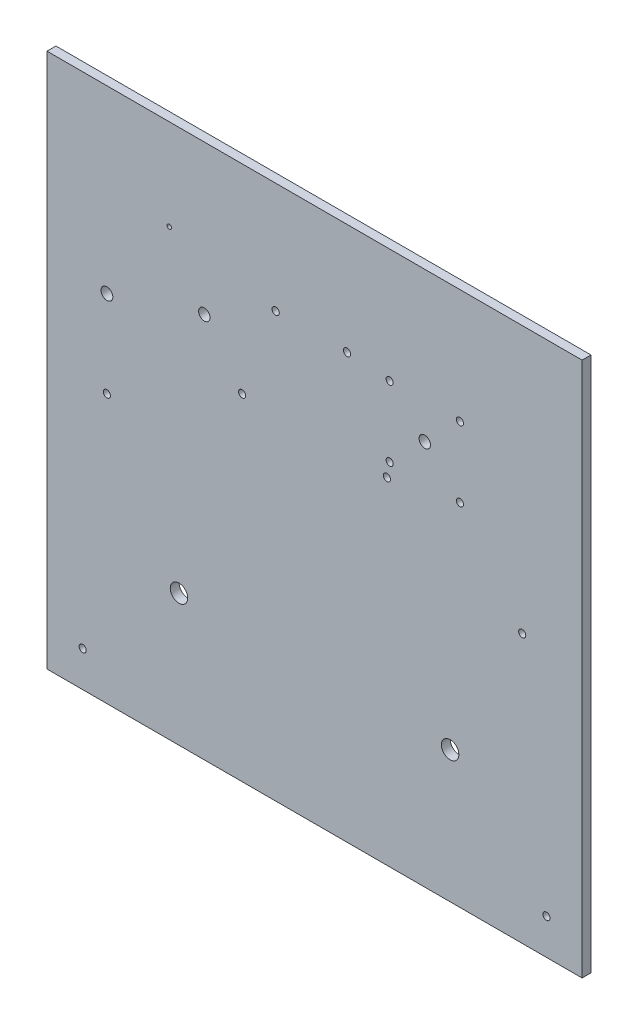
from build123d import *

# Parameters (mm, degrees)
SKETCH1_W               = 381
SKETCH1_H               = 381
SKETCH1_R               = 4.064
SKETCH1_R_2             = 2.54
SKETCH1_R_3             = 6.223
SKETCH1_R_4             = 2.5796875
SKETCH1_R_5             = 1.5875
BOSS_EXTRUDE1_DEPTH     = 6.35
F_3_8_24_TAPPED_HOLE2_D = 8.4328


with BuildPart() as part:
    # Sketch1 → Boss-Extrude1 (new body)
    with BuildSketch(Plane.XY):
        with Locations((27.686, -103.707177239)):
            Rectangle(SKETCH1_W, SKETCH1_H)
        with Locations((106.172, -19.5453)):
            Circle(SKETCH1_R, mode=Mode.SUBTRACT)
        with Locations((79.231231637, -55.022746953)):
            Circle(SKETCH1_R_2, mode=Mode.SUBTRACT)
        with Locations((192.786, -268.807177239)):
            Circle(SKETCH1_R_2, mode=Mode.SUBTRACT)
        with Locations((-137.414, -268.807177239)):
            Circle(SKETCH1_R_2, mode=Mode.SUBTRACT)
        with Locations((131.172, 5.4547)):
            Circle(SKETCH1_R_2, mode=Mode.SUBTRACT)
        with Locations((175.53653879, -103.112365579)):
            Circle(SKETCH1_R_2, mode=Mode.SUBTRACT)
        with Locations((131.172, -44.5453)):
            Circle(SKETCH1_R_2, mode=Mode.SUBTRACT)
        with Locations((124.206, -200.410050779)):
            Circle(SKETCH1_R_3, mode=Mode.SUBTRACT)
        with Locations((-68.834, -200.410050779)):
            Circle(SKETCH1_R_3, mode=Mode.SUBTRACT)
        with Locations((81.172, -44.5453)):
            Circle(SKETCH1_R_2, mode=Mode.SUBTRACT)
        with Locations((-120.16453879, -103.112365579)):
            Circle(SKETCH1_R_2, mode=Mode.SUBTRACT)
        with Locations((81.172, 5.4547)):
            Circle(SKETCH1_R_2, mode=Mode.SUBTRACT)
        with Locations((0, 7.933100659)):
            Circle(SKETCH1_R_4, mode=Mode.SUBTRACT)
        with Locations((50.8, 7.933100659)):
            Circle(SKETCH1_R_4, mode=Mode.SUBTRACT)
        with Locations((-23.859231637, -55.022746953)):
            Circle(SKETCH1_R_2, mode=Mode.SUBTRACT)
        with Locations((-50.8, -19.5453)):
            Circle(SKETCH1_R, mode=Mode.SUBTRACT)
        with Locations((-75.71453879, 22.103817211)):
            Circle(SKETCH1_R_5, mode=Mode.SUBTRACT)
    extrude(amount=BOSS_EXTRUDE1_DEPTH)

    # 3/8-24 Tapped Hole2 (through all)
    with Locations(Plane.XY.offset(6.35)):
        with Locations((-120.16453879, -41.390365579)):
            Hole(F_3_8_24_TAPPED_HOLE2_D / 2)


solid = part.part
